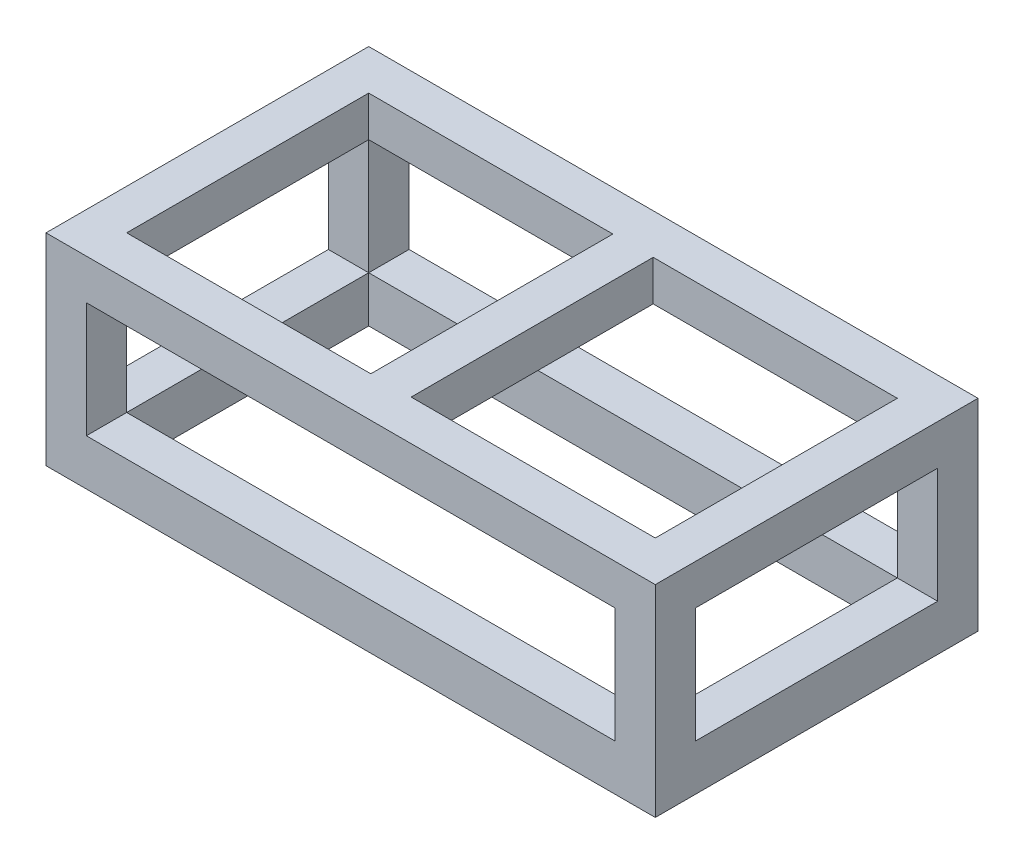
from build123d import *

# Parameters (mm, degrees)
SKETCH2_W           = 528.64321608
SKETCH2_H           = 280
SKETCH2_W_2         = 211.82160804
SKETCH2_H_2         = 210
BOSS_EXTRUDE1_DEPTH = 35
SKETCH3_W           = 35
SKETCH3_H           = 35
BOSS_EXTRUDE2_DEPTH = 100
SHELL1_T            = -2
SKETCH4_W           = 528.64321608
SKETCH4_H           = 280
SKETCH4_W_2         = 458.64321608
SKETCH4_H_2         = 210
BOSS_EXTRUDE3_DEPTH = 40


with BuildPart() as part:
    # Sketch2 → Boss-Extrude1 (new body)
    with BuildSketch(Plane(origin=(0, -266, 0), x_dir=(1, 0, 0), z_dir=(0, 1, 0))):
        with Locations((124.32160804, 0)):
            Rectangle(SKETCH2_W, SKETCH2_H)
        with Locations((0.91080402, 0)):
            Rectangle(SKETCH2_W_2, SKETCH2_H_2, mode=Mode.SUBTRACT)
        with Locations((247.73241206, 0)):
            Rectangle(SKETCH2_W_2, SKETCH2_H_2, mode=Mode.SUBTRACT)
    extrude(amount=-BOSS_EXTRUDE1_DEPTH)

    # Sketch3 → Boss-Extrude2 (add)
    with BuildSketch(Plane(origin=(0, -301, 0), x_dir=(-1, 0, 0), z_dir=(0, -1, 0))):
        with Locations((122.5, -122.5)):
            Rectangle(SKETCH3_W, SKETCH3_H)
        with Locations((122.5, 122.5)):
            Rectangle(SKETCH3_W, SKETCH3_H)
        with Locations((-371.14321608, 122.5)):
            Rectangle(SKETCH3_W, SKETCH3_H)
        with Locations((-371.14321608, -122.5)):
            Rectangle(SKETCH3_W, SKETCH3_H)
    extrude(amount=BOSS_EXTRUDE2_DEPTH)

    # Shell1
    shell1_openings = [part.faces().sort_by_distance(p)[0] for p in [
        (-122.5, -401, 122.5),
        (-122.5, -401, -122.5),
        (371.14321608, -401, 122.5),
        (371.14321608, -401, -122.5),
    ]]
    offset(amount=SHELL1_T, openings=shell1_openings, kind=Kind.INTERSECTION)

    # Sketch4 → Boss-Extrude3 (add)
    with BuildSketch(Plane.XZ.offset(401)):
        with Locations((124.32160804, 0)):
            Rectangle(SKETCH4_W, SKETCH4_H)
        with Locations((124.32160804, 0)):
            Rectangle(SKETCH4_W_2, SKETCH4_H_2, mode=Mode.SUBTRACT)
    extrude(amount=BOSS_EXTRUDE3_DEPTH)


solid = part.part
